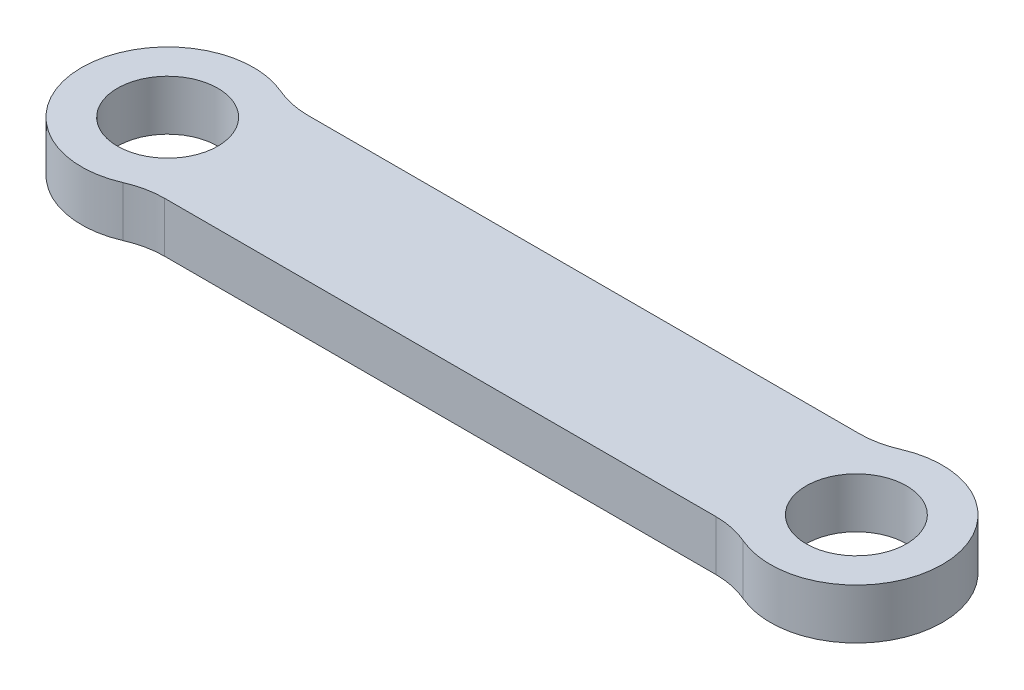
from build123d import *

# Parameters (mm, degrees)
SKETCH1_R           = 1.75
BOSS_EXTRUDE1_DEPTH = 1.75
FILLET1_R           = 3


with BuildPart() as part:
    # Sketch1 → Boss-Extrude1 (new body)
    with BuildSketch(Plane(origin=(0, 0, 0), x_dir=(1, 0, 0), z_dir=(0, 1, 0))):
        with BuildLine():
            ThreePointArc((1.658312395, 2.5), (-3, 0), (1.658312395, -2.5))
            Line((1.658312395, -2.5), (22.341687605, -2.5))
            ThreePointArc((22.341687605, -2.5), (27, 0), (22.341687605, 2.5))
            Line((22.341687605, 2.5), (1.658312395, 2.5))
        make_face()
        Circle(SKETCH1_R, mode=Mode.SUBTRACT)
        with Locations((24, 0)):
            Circle(SKETCH1_R, mode=Mode.SUBTRACT)
    extrude(amount=BOSS_EXTRUDE1_DEPTH)

    # Fillet1
    fillet1_edges = [part.edges().sort_by_distance(p)[0] for p in [
        (1.658312395, 0.875, 2.5),
        (22.341687605, 0.875, 2.5),
        (22.341687605, 0.875, -2.5),
        (1.658312395, 0.875, -2.5),
    ]]
    fillet(fillet1_edges, radius=FILLET1_R)


solid = part.part
